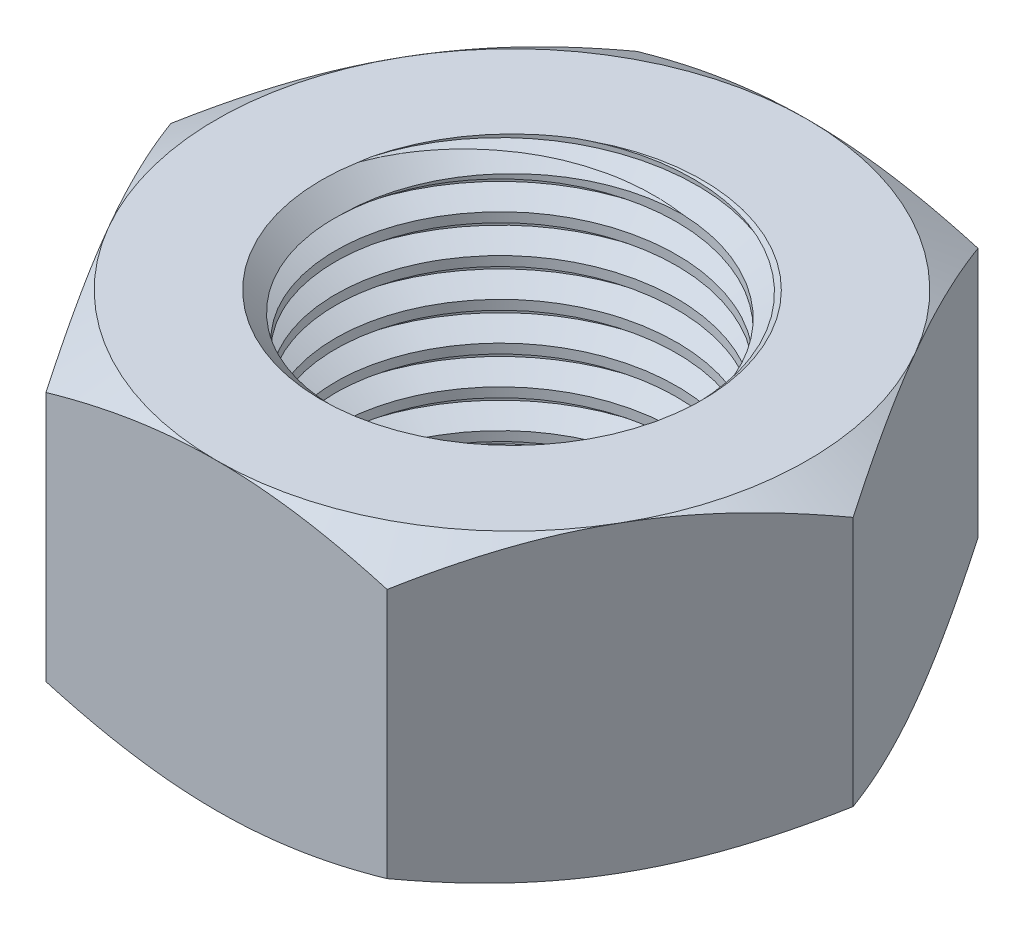
from build123d import *

# Parameters (mm, degrees)
BOSS_EXTRUDE1_DEPTH              = 8
M10X1_0_TAPPED_HOLE3_D           = 9
M10X1_0_TAPPED_HOLE3_CSINK_D     = 10.05
M10X1_0_TAPPED_HOLE3_CSINK_ANGLE = 90
THREAD1_PITCH                    = 1


with BuildPart() as part:
    # Sketch1 → Boss-Extrude1 (new body)
    with BuildSketch(Plane(origin=(0, 0, 0), x_dir=(1, 0, 0), z_dir=(0, 1, 0))):
        Polygon((4.5, -7.794228634), (9, 0), (4.5, 7.794228634), (-4.5, 7.794228634), (-9, 0), (-4.5, -7.794228634), align=None)
    extrude(amount=BOSS_EXTRUDE1_DEPTH)

    # Sketch2 → Cut-Revolve1 (revolve, cut)
    with BuildSketch(Plane(origin=(0, 0, 0), x_dir=(0, 0, -1), z_dir=(1, 0, 0))):
        Polygon((7.794228634, 0), (11.855006462, 0), (11.855006462, 2.344491172), align=None)
        Polygon((11.855006462, 5.655508828), (7.794228634, 8), (11.855006462, 8), align=None)
    revolve(axis=Axis((0, -1000, 0), (0, 1, 0)), mode=Mode.SUBTRACT)

    # M10x1.0 Tapped Hole3 (through all)
    with Locations(Plane(origin=(0, 8, 0), x_dir=(1, 0, 0), z_dir=(0, 1, 0))):
        with Locations((0, 0)):
            CounterSinkHole(M10X1_0_TAPPED_HOLE3_D / 2, M10X1_0_TAPPED_HOLE3_CSINK_D / 2, counter_sink_angle=M10X1_0_TAPPED_HOLE3_CSINK_ANGLE)

    # Thread1: the profile of Thread Profile1 profile screwed along a right-hand helix of 8.475 turns, 8 arcs to a turn; built about Z, then put on its axis
    thread1_z = Axis((0, 0, 0), (0, 0, 1))
    thread1_corners = [(4.4997, 0, -0.000173205), (5.041265875, 0, 0.312499999), (5.041265875, 0, 0.437499999), (4.4997, 0, 0.750173202)]
    with BuildLine(mode=Mode.PRIVATE) as thread1_profile:
        Line(thread1_corners[0], thread1_corners[1])
        Line(thread1_corners[1], thread1_corners[2])
        Line(thread1_corners[2], thread1_corners[3])
        Line(thread1_corners[3], thread1_corners[0])
    thread1_cap = Face(thread1_profile.wire())
    thread1_turn_angles = [0, 22.5, 45, 67.5, 90, 112.5, 135, 157.5, 180, 202.5, 225, 247.5, 270, 292.5, 315, 337.5, 360]
    thread1_turn_weights = [1, 0.9238795325112867, 1, 0.9238795325112867, 1, 0.9238795325112867, 1, 0.9238795325112867, 1, 0.9238795325112867, 1, 0.9238795325112867, 1, 0.9238795325112867, 1, 0.9238795325112867, 1]
    thread1_turn_rails = [Edge.make_bspline([Vector(p[0], p[1], 0).rotate(thread1_z, thread1_turn_angles[k]) / thread1_turn_weights[k] + Vector(0, 0, p[2] + THREAD1_PITCH * thread1_turn_angles[k] / 360) for k in range(17)], [0, 0, 0, 1, 1, 2, 2, 3, 3, 4, 4, 5, 5, 6, 6, 7, 7, 8, 8, 8], 2, thread1_turn_weights) for p in thread1_corners]
    thread1_turn_sides = [Face.make_surface_from_curves(thread1_turn_rails[p[0]], thread1_turn_rails[p[1]]) for p in [(0, 1), (1, 2), (2, 3), (3, 0)]]
    thread1_last_angles = [2880, 2902.5, 2925, 2947.5, 2970, 2992.5, 3015, 3033, 3051]
    thread1_last_weights = [1, 0.9238795325112867, 1, 0.9238795325112867, 1, 0.9238795325112867, 1, 0.9510565162951499, 1]
    thread1_last_rails = [Edge.make_bspline([Vector(p[0], p[1], 0).rotate(thread1_z, thread1_last_angles[k]) / thread1_last_weights[k] + Vector(0, 0, p[2] + THREAD1_PITCH * thread1_last_angles[k] / 360) for k in range(9)], [0, 0, 0, 1, 1, 2, 2, 3, 3, 4, 4, 4], 2, thread1_last_weights) for p in thread1_corners]
    thread1_last_sides = [Face.make_surface_from_curves(thread1_last_rails[p[0]], thread1_last_rails[p[1]]) for p in [(0, 1), (1, 2), (2, 3), (3, 0)]]
    thread1 = Plane(origin=(0, 8.475, 0), x_dir=(-1, 0, 0), z_dir=(0, -1, 0)) * Solid(Shell([*[p.moved(Location((0, 0, THREAD1_PITCH * i))) for i in range(8) for p in thread1_turn_sides], *thread1_last_sides, thread1_cap, thread1_cap.rotate(thread1_z, 3051).moved(Location((0, 0, THREAD1_PITCH * 3051 / 360)))]))
    add(thread1, mode=Mode.SUBTRACT)


solid = part.part
